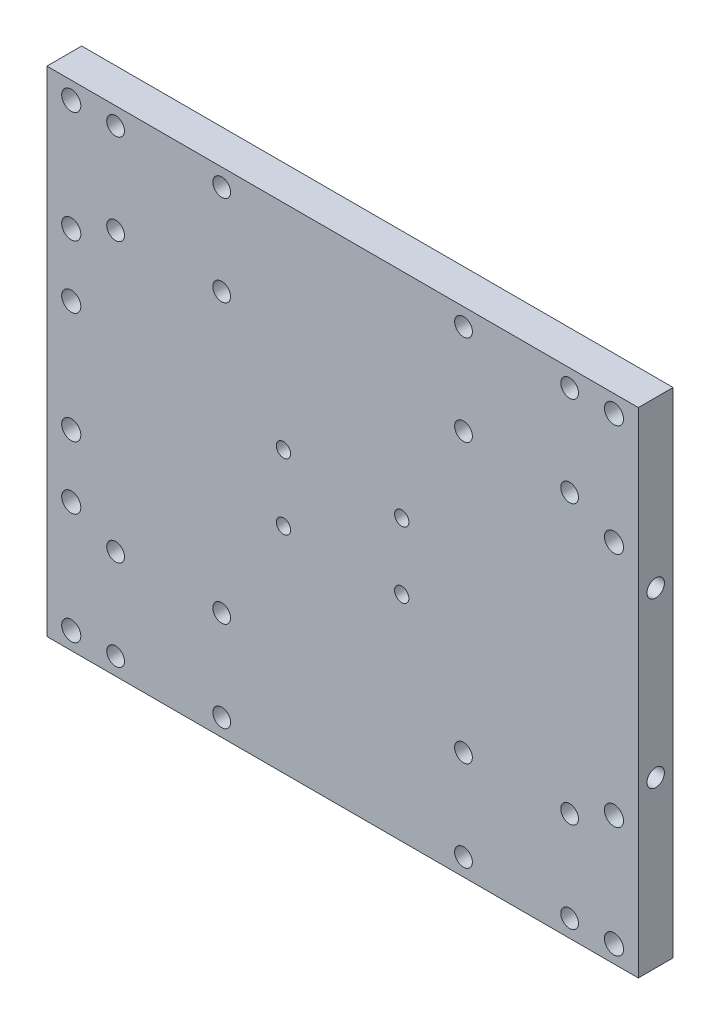
from build123d import *

# Parameters (mm, degrees)
SKETCH1_W           = 170
SKETCH1_H           = 142
BOSS_EXTRUDE1_DEPTH = 5
SKETCH2_R           = 2.55
CUT_EXTRUDE1_DEPTH  = 112.202517957
SKETCH3_R           = 2.75
CUT_EXTRUDE2_DEPTH  = 112.202517957
SKETCH4_R           = 2.05
CUT_EXTRUDE3_DEPTH  = 112.202517957
SKETCH5_R           = 2.5
CUT_EXTRUDE4_DEPTH  = 10
SKETCH6_R           = 2.75
CUT_EXTRUDE5_DEPTH  = 112.202517957


with BuildPart() as part:
    # Sketch1 → Boss-Extrude1 (new, symmetric)
    with BuildSketch(Plane.XY):
        Rectangle(SKETCH1_W, SKETCH1_H)
    extrude(amount=BOSS_EXTRUDE1_DEPTH, both=True)

    # Sketch2 → Cut-Extrude1 (cut, through all)
    with BuildSketch(Plane.XY.offset(5)):
        with Locations((-65.25, 66)):
            Circle(SKETCH2_R)
        with Locations((-34.75, 66)):
            Circle(SKETCH2_R)
        with Locations((-34.75, 40)):
            Circle(SKETCH2_R)
        with Locations((-65.25, 40)):
            Circle(SKETCH2_R)
        with Locations((65.25, 66)):
            Circle(SKETCH2_R)
        with Locations((65.25, 40)):
            Circle(SKETCH2_R)
        with Locations((34.75, 40)):
            Circle(SKETCH2_R)
        with Locations((34.75, 66)):
            Circle(SKETCH2_R)
        with Locations((-65.25, -40)):
            Circle(SKETCH2_R)
        with Locations((-34.75, -40)):
            Circle(SKETCH2_R)
        with Locations((-34.75, -66)):
            Circle(SKETCH2_R)
        with Locations((-65.25, -66)):
            Circle(SKETCH2_R)
        with Locations((34.75, -40)):
            Circle(SKETCH2_R)
        with Locations((65.25, -40)):
            Circle(SKETCH2_R)
        with Locations((65.25, -66)):
            Circle(SKETCH2_R)
        with Locations((34.75, -66)):
            Circle(SKETCH2_R)
    extrude(amount=-CUT_EXTRUDE1_DEPTH, mode=Mode.SUBTRACT)

    # Sketch3 → Cut-Extrude2 (cut, through all)
    with BuildSketch(Plane.XY.offset(5)):
        with Locations((-78, 66)):
            Circle(SKETCH3_R)
        with Locations((-78, 34)):
            Circle(SKETCH3_R)
        with Locations((-78, -34)):
            Circle(SKETCH3_R)
        with Locations((-78, -66)):
            Circle(SKETCH3_R)
        with Locations((78, 66)):
            Circle(SKETCH3_R)
        with Locations((78, 34)):
            Circle(SKETCH3_R)
        with Locations((78, -34)):
            Circle(SKETCH3_R)
        with Locations((78, -66)):
            Circle(SKETCH3_R)
    extrude(amount=-CUT_EXTRUDE2_DEPTH, mode=Mode.SUBTRACT)

    # Sketch4 → Cut-Extrude3 (cut, through all)
    with BuildSketch(Plane.XY.offset(5)):
        with Locations((-17, 9.5)):
            Circle(SKETCH4_R)
        with Locations((-17, -9.5)):
            Circle(SKETCH4_R)
        with Locations((17, -9.5)):
            Circle(SKETCH4_R)
        with Locations((17, 9.5)):
            Circle(SKETCH4_R)
    extrude(amount=-CUT_EXTRUDE3_DEPTH, mode=Mode.SUBTRACT)

    # Sketch5 → Cut-Extrude4 (cut)
    with BuildSketch(Plane(origin=(85, 0, 0), x_dir=(0, 0, -1), z_dir=(1, 0, 0))):
        with Locations((0, 23.6)):
            Circle(SKETCH5_R)
        with Locations((0, -23.6)):
            Circle(SKETCH5_R)
    extrude(amount=-CUT_EXTRUDE4_DEPTH, mode=Mode.SUBTRACT)

    # Sketch6 → Cut-Extrude5 (cut, through all)
    with BuildSketch(Plane.XY.offset(5)):
        with Locations((-78, 16)):
            Circle(SKETCH6_R)
        with Locations((-78, -16)):
            Circle(SKETCH6_R)
    extrude(amount=-CUT_EXTRUDE5_DEPTH, mode=Mode.SUBTRACT)


solid = part.part
